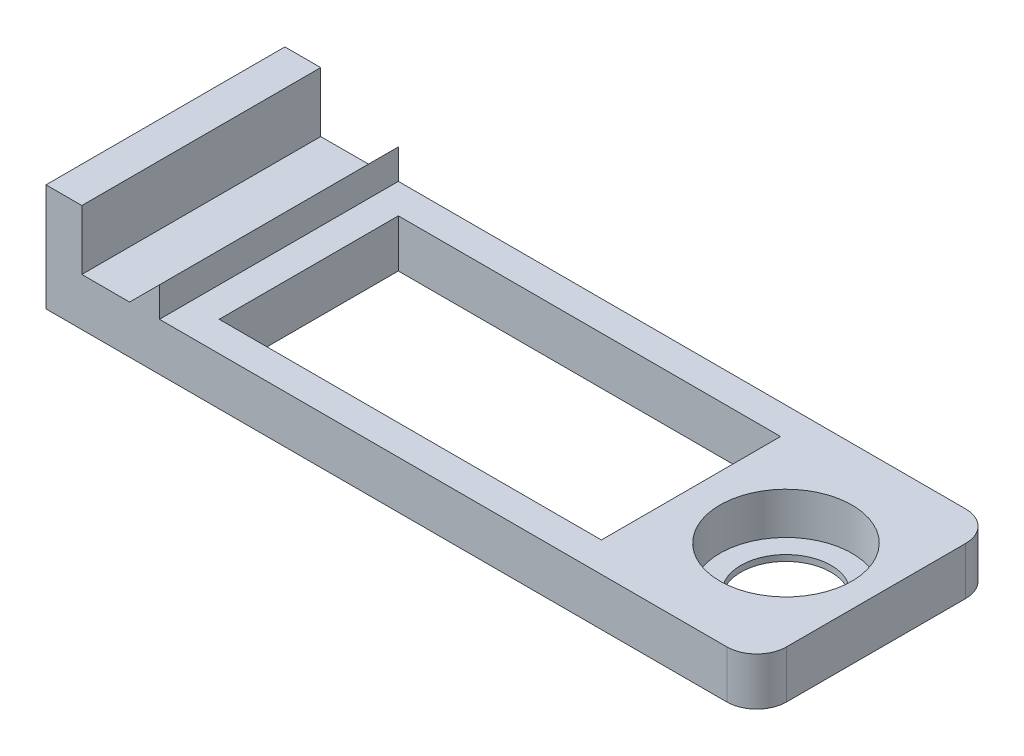
from build123d import *

# Parameters (mm, degrees)
SKETCH1_W           = 119
SKETCH1_H           = 40
BOSS_EXTRUDE1_DEPTH = 8
SKETCH2_R           = 11.05
CUT_EXTRUDE1_DEPTH  = 7
CUT_EXTRUDE2_REACH  = 65.279
SKETCH3_R           = 7.55
SKETCH4_W           = 6
SKETCH4_H           = 40
BOSS_EXTRUDE2_DEPTH = 10
BOSS_EXTRUDE3_DEPTH = 40
FILLET1_R           = 5
CUT_EXTRUDE3_REACH  = 65.563
SKETCH7_W           = 64
SKETCH7_H           = 30


with BuildPart() as part:
    # Sketch1 → Boss-Extrude1 (new body)
    with BuildSketch(Plane(origin=(0, 0, 0), x_dir=(1, 0, 0), z_dir=(0, 1, 0))):
        Rectangle(SKETCH1_W, SKETCH1_H)
    extrude(amount=BOSS_EXTRUDE1_DEPTH)

    # Sketch2 → Cut-Extrude1 (cut)
    with BuildSketch(Plane(origin=(0, 8, 0), x_dir=(1, 0, 0), z_dir=(0, 1, 0))):
        with Locations((44.4, 0)):
            Circle(SKETCH2_R)
    extrude(amount=-CUT_EXTRUDE1_DEPTH, mode=Mode.SUBTRACT)

    # Sketch3 → Cut-Extrude2 (cut, up to next)
    with BuildSketch(Plane.XZ, mode=Mode.PRIVATE) as cut_extrude2_sk1:
        with Locations((44.4, 0)):
            Circle(SKETCH3_R)
    cut_extrude2_tool1 = extrude(cut_extrude2_sk1.sketch, amount=-CUT_EXTRUDE2_REACH, mode=Mode.PRIVATE) & part.part
    add(cut_extrude2_tool1.solids().sort_by_distance((44.4, 0, 0))[0], mode=Mode.SUBTRACT)

    # Sketch4 → Boss-Extrude2 (add)
    with BuildSketch(Plane(origin=(0, 8, 0), x_dir=(1, 0, 0), z_dir=(0, 1, 0))):
        with Locations((-56.5, 0)):
            Rectangle(SKETCH4_W, SKETCH4_H)
    extrude(amount=BOSS_EXTRUDE2_DEPTH)

    # Sketch6 → Boss-Extrude3 (add)
    with BuildSketch(Plane.XY.offset(20)):
        Polygon((-40.5, 8), (-40.5, 13), (-45.5, 8), align=None)
    extrude(amount=-BOSS_EXTRUDE3_DEPTH)

    # Fillet1
    fillet1_edges = [part.edges().sort_by_distance(p)[0] for p in [
        (59.5, 4, 20),
        (59.5, 4, -20),
    ]]
    fillet(fillet1_edges, radius=FILLET1_R)

    # Sketch7 → Cut-Extrude3 (cut, up to next)
    with BuildSketch(Plane(origin=(0, 8, 0), x_dir=(1, 0, 0), z_dir=(0, 1, 0)), mode=Mode.PRIVATE) as cut_extrude3_sk1:
        with Locations((-3.5, 0)):
            Rectangle(SKETCH7_W, SKETCH7_H)
    cut_extrude3_tool1 = extrude(cut_extrude3_sk1.sketch, amount=-CUT_EXTRUDE3_REACH, mode=Mode.PRIVATE) & part.part
    add(cut_extrude3_tool1.solids().sort_by_distance((-3.5, 8, 0))[0], mode=Mode.SUBTRACT)


solid = part.part
